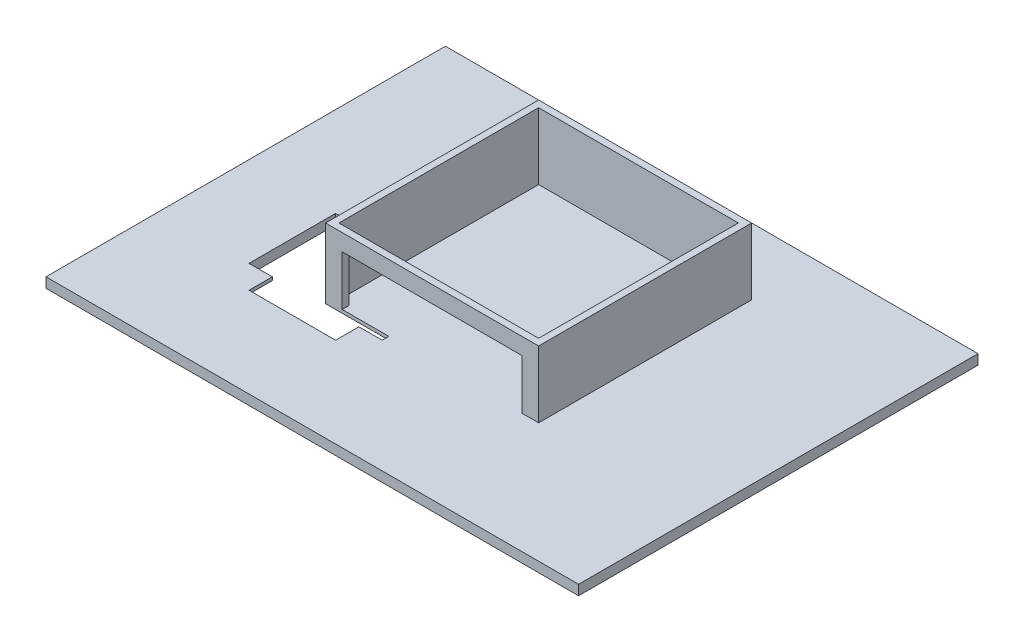
from build123d import *

# Parameters (mm, degrees)
SKETCH1_W           = 160
SKETCH1_H           = 120
BOSS_EXTRUDE1_DEPTH = 3
SKETCH2_R           = 3
CUT_EXTRUDE1_DEPTH  = 2
SKETCH3_W           = 40
SKETCH3_H           = 40
CUT_EXTRUDE2_DEPTH  = 2
CUT_EXTRUDE3_DEPTH  = 1
BOSS_EXTRUDE2_DEPTH = 20
BOSS_EXTRUDE3_DEPTH = 1
SKETCH7_W           = 60
SKETCH7_H           = 60
CUT_EXTRUDE4_DEPTH  = 20
CUT_EXTRUDE5_REACH  = 120.258
SKETCH8_W           = 54
SKETCH8_H           = 15


with BuildPart() as part:
    # Sketch1 → Boss-Extrude1 (new body)
    with BuildSketch(Plane(origin=(0, 0, 0), x_dir=(1, 0, 0), z_dir=(0, 1, 0))):
        Rectangle(SKETCH1_W, SKETCH1_H)
    extrude(amount=BOSS_EXTRUDE1_DEPTH)

    # Sketch2 → Cut-Extrude1 (cut)
    with BuildSketch(Plane.XZ):
        with Locations((-70, 50)):
            Circle(SKETCH2_R)
        with Locations((0, 50)):
            Circle(SKETCH2_R)
        with Locations((70, 50)):
            Circle(SKETCH2_R)
        with Locations((-70, 0)):
            Circle(SKETCH2_R)
        with Locations((70, 0)):
            Circle(SKETCH2_R)
        with Locations((-70, -50)):
            Circle(SKETCH2_R)
        with Locations((0, -50)):
            Circle(SKETCH2_R)
        with Locations((70, -50)):
            Circle(SKETCH2_R)
    extrude(amount=-CUT_EXTRUDE1_DEPTH, mode=Mode.SUBTRACT)

    # Sketch3 → Cut-Extrude2 (cut)
    with BuildSketch(Plane.XZ):
        with Locations((-33, 13)):
            Rectangle(SKETCH3_W, SKETCH3_H)
    extrude(amount=-CUT_EXTRUDE2_DEPTH, mode=Mode.SUBTRACT)

    # Sketch4 → Cut-Extrude3 (cut)
    with BuildSketch(Plane.XZ.offset(-2)):
        Polygon((-46, 33), (-20, 33), (-20, 26), (-13, 26), (-13, 0), (-20, 0), (-20, -7), (-46, -7), (-46, 0), (-53, 0), (-53, 26), (-46, 26), align=None)
    extrude(amount=-CUT_EXTRUDE3_DEPTH, mode=Mode.SUBTRACT)

    # Sketch5 → Boss-Extrude2 (add)
    with BuildSketch(Plane(origin=(0, 3, 0), x_dir=(1, 0, 0), z_dir=(0, 1, 0))):
        Polygon((0, 40), (-32, 40), (-32, -24), (32, -24), (32, 40), align=None)
    extrude(amount=BOSS_EXTRUDE2_DEPTH)

    # Sketch6 → Boss-Extrude3 (add)
    with BuildSketch(Plane.XZ.offset(-3)):
        Polygon((-32, 24), (-13, 24), (-13, 0), (-20, 0), (-20, -7), (-32, -7), align=None)
    extrude(amount=BOSS_EXTRUDE3_DEPTH)

    # Sketch7 → Cut-Extrude4 (cut)
    with BuildSketch(Plane(origin=(0, 23, 0), x_dir=(1, 0, 0), z_dir=(0, 1, 0))):
        with Locations((0, 8)):
            Rectangle(SKETCH7_W, SKETCH7_H)
    extrude(amount=-CUT_EXTRUDE4_DEPTH, mode=Mode.SUBTRACT)

    # Sketch8 → Cut-Extrude5 (cut, up to next)
    with BuildSketch(Plane.XY.offset(24), mode=Mode.PRIVATE) as cut_extrude5_sk1:
        with Locations((0, 10.5)):
            Rectangle(SKETCH8_W, SKETCH8_H)
    cut_extrude5_tool1 = extrude(cut_extrude5_sk1.sketch, amount=-CUT_EXTRUDE5_REACH, mode=Mode.PRIVATE) & part.part
    add(cut_extrude5_tool1.solids().sort_by_distance((0, 10.5, 24))[0], mode=Mode.SUBTRACT)


solid = part.part
